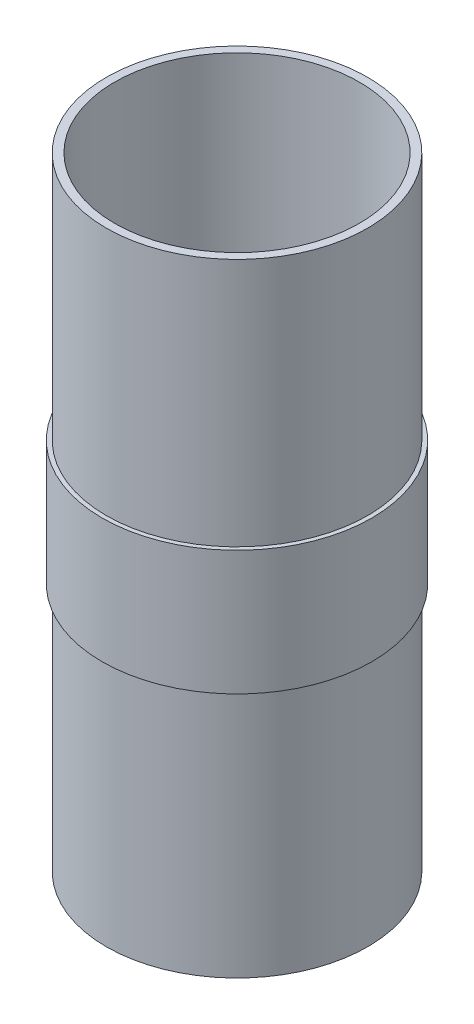
from build123d import *

# Parameters (mm, degrees)
ESBO_O1_R                = 31.5
ESBO_O1_R_2              = 29.5
RESSALTO_EXTRUS_O1_DEPTH = 60
ESBO_O2_R                = 32.5
ESBO_O2_R_2              = 29.5
RESSALTO_EXTRUS_O2_DEPTH = 30
ESBO_O3_R                = 31.5
ESBO_O3_R_2              = 29.5
RESSALTO_EXTRUS_O3_DEPTH = 60
ESBO_O6_R                = 30.5
RESSALTO_EXTRUS_O4_DEPTH = 5


with BuildPart() as part:
    # Esboço1 → Ressalto-extrusão1 (new body)
    with BuildSketch(Plane(origin=(0, 0, 0), x_dir=(1, 0, 0), z_dir=(0, 1, 0))):
        Circle(ESBO_O1_R)
        Circle(ESBO_O1_R_2, mode=Mode.SUBTRACT)
    extrude(amount=RESSALTO_EXTRUS_O1_DEPTH)


with BuildPart() as body_2:
    # Esboço2 → Ressalto-extrusão2 (new body)
    with BuildSketch(Plane(origin=(0, 60, 0), x_dir=(1, 0, 0), z_dir=(0, 1, 0))):
        Circle(ESBO_O2_R)
        Circle(ESBO_O2_R_2, mode=Mode.SUBTRACT)
    extrude(amount=RESSALTO_EXTRUS_O2_DEPTH)



with BuildPart() as body_3:
    # Esboço3 → Ressalto-extrusão3 (new body)
    with BuildSketch(Plane(origin=(0, 90, 0), x_dir=(1, 0, 0), z_dir=(0, 1, 0))):
        Circle(ESBO_O3_R)
        Circle(ESBO_O3_R_2, mode=Mode.SUBTRACT)
    extrude(amount=RESSALTO_EXTRUS_O3_DEPTH)


with BuildPart() as body_2_1:
    add(body_2.part)

    add(body_3.part)  # Ressalto-extrusão4 merges body 3
    # Esboço6 → Ressalto-extrusão4 (add)
    with BuildSketch(Plane(origin=(0, 90, 0), x_dir=(1, 0, 0), z_dir=(0, 1, 0))):
        Circle(ESBO_O6_R)
    extrude(amount=-RESSALTO_EXTRUS_O4_DEPTH)


with BuildPart() as part_1:
    add(part.part)

    # Combinar3: union body 2
    add(body_2_1.part)


solid = part_1.part
